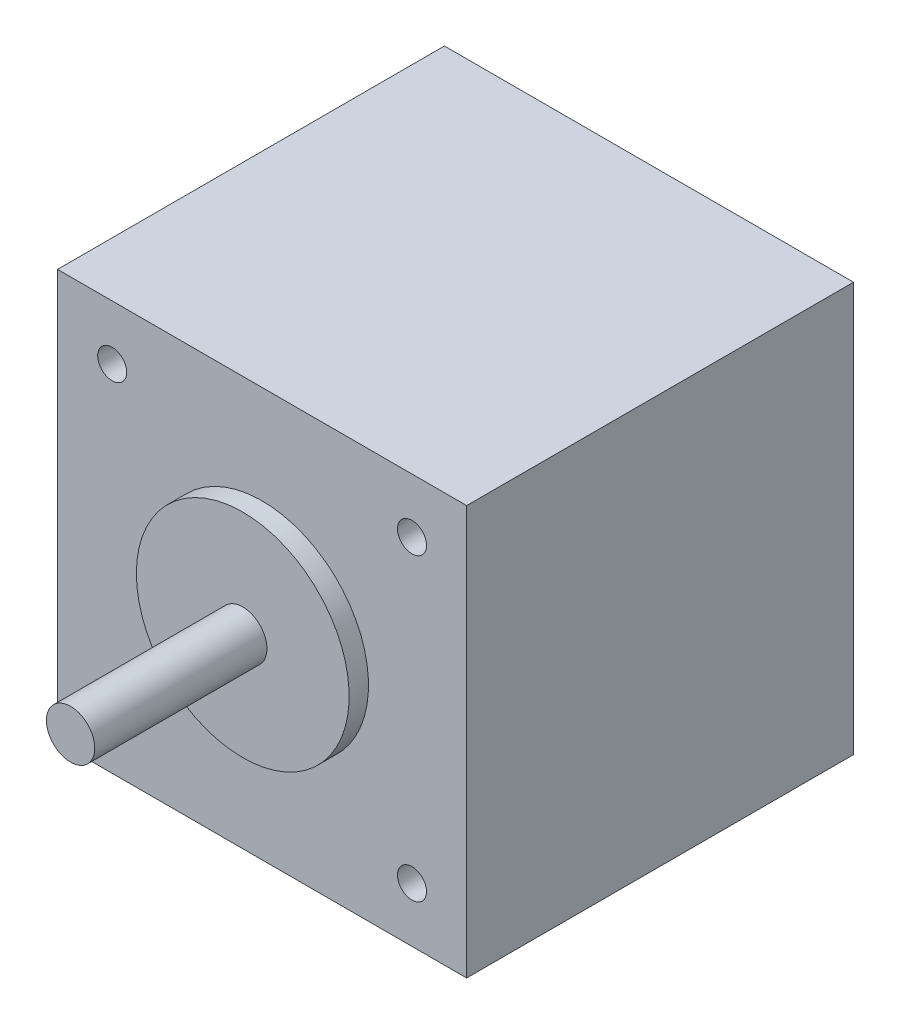
from build123d import *

# Parameters (mm, degrees)
SKETCH_1_W          = 42.3
SKETCH_1_H          = 42.3
EXTRUDE_1229_DEPTH  = 40
SKETCH_2_R          = 2.5
EXTRUDE_1284_DEPTH  = 59.8
SKETCH_3_R          = 11
EXTRUDE_1331_DEPTH  = 42
CUT_EXTRUDE_START   = 40
SKETCH_5_R          = 1.5
CUT_EXTRUDE_3_DEPTH = 4.5


with BuildPart() as part:
    # Эскиз1 → Extrude 1229 (new body)
    with BuildSketch(Plane.XY):
        Rectangle(SKETCH_1_W, SKETCH_1_H)
    extrude(amount=EXTRUDE_1229_DEPTH)

    # Эскиз2 → Extrude 1284 (add)
    with BuildSketch(Plane.XY):
        Circle(SKETCH_2_R)
    extrude(amount=EXTRUDE_1284_DEPTH)

    # Эскиз3 → Extrude 1331 (add)
    with BuildSketch(Plane.XY):
        Circle(SKETCH_3_R)
    extrude(amount=EXTRUDE_1331_DEPTH)

    # Эскиз5 → Крепеж_М3_ПРЕДВ (cut)
    with BuildSketch(Plane.XY.offset(CUT_EXTRUDE_START)):
        with Locations((-15.5, -15.5)):
            Circle(SKETCH_5_R)
        with Locations((-15.5, 15.5)):
            Circle(SKETCH_5_R)
        with Locations((15.5, -15.5)):
            Circle(SKETCH_5_R)
        with Locations((15.5, 15.5)):
            Circle(SKETCH_5_R)
    extrude(amount=-CUT_EXTRUDE_3_DEPTH, mode=Mode.SUBTRACT)


solid = part.part
